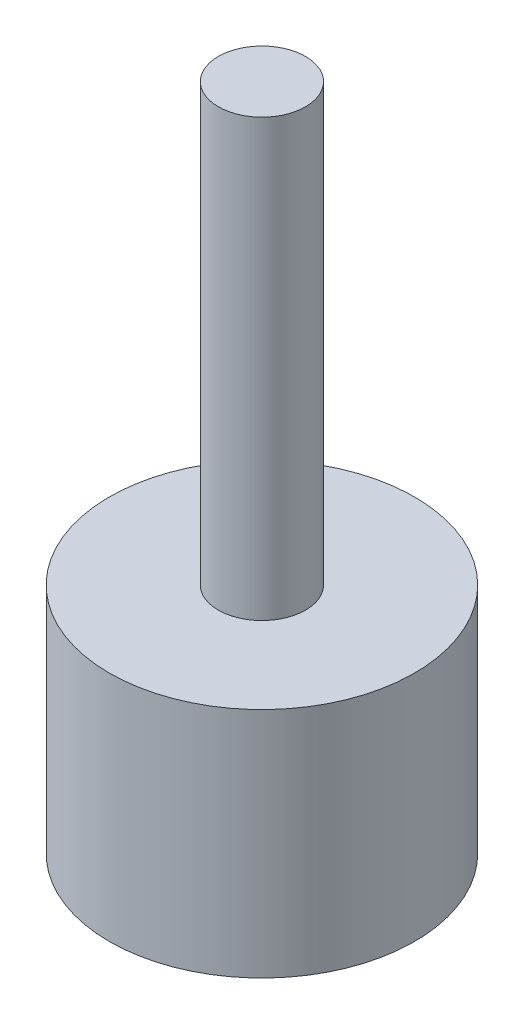
from build123d import *

# Parameters (mm, degrees)
SKETCH1_R           = 5.25
BOSS_EXTRUDE1_DEPTH = 8
SKETCH2_R           = 1.5
BOSS_EXTRUDE2_DEPTH = 15
SKETCH3_W           = 5
SKETCH3_H           = 3.05
CUT_EXTRUDE1_DEPTH  = 6


with BuildPart() as part:
    # Sketch1 → Boss-Extrude1 (new body)
    with BuildSketch(Plane(origin=(0, 0, 0), x_dir=(1, 0, 0), z_dir=(0, 1, 0))):
        Circle(SKETCH1_R)
    extrude(amount=BOSS_EXTRUDE1_DEPTH)

    # Sketch2 → Boss-Extrude2 (add)
    with BuildSketch(Plane(origin=(0, 8, 0), x_dir=(1, 0, 0), z_dir=(0, 1, 0))):
        Circle(SKETCH2_R)
    extrude(amount=BOSS_EXTRUDE2_DEPTH)

    # Sketch3 → Cut-Extrude1 (cut)
    with BuildSketch(Plane.XZ):
        Rectangle(SKETCH3_W, SKETCH3_H)
    extrude(amount=-CUT_EXTRUDE1_DEPTH, mode=Mode.SUBTRACT)


solid = part.part
